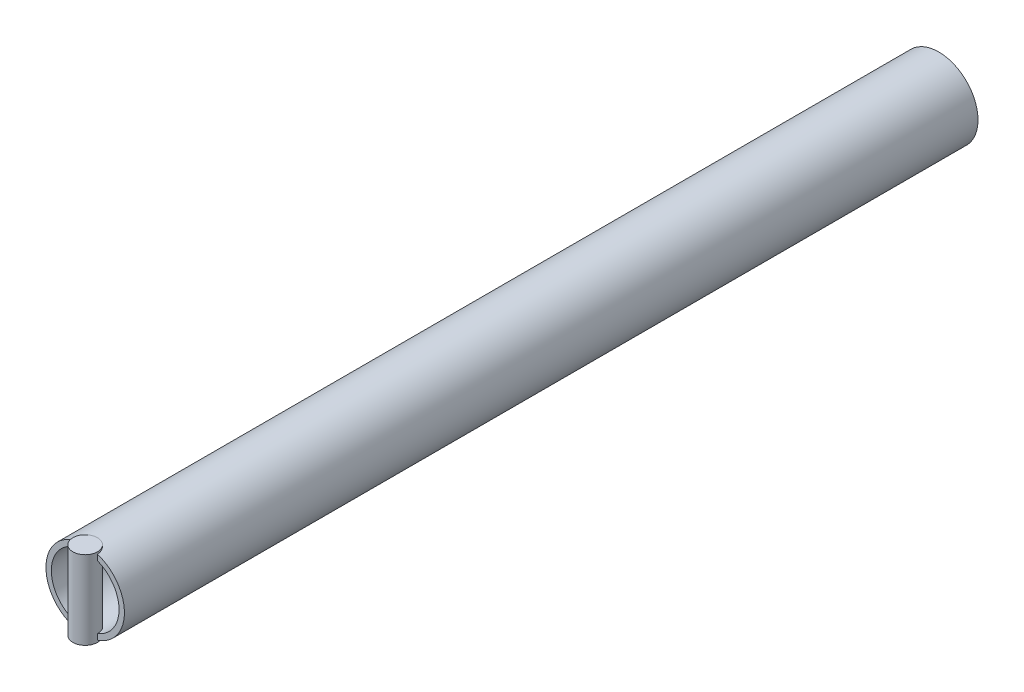
from build123d import *
from build123d.topology import SkipClean

# Parameters (mm, degrees)
SKETCH1_R                = 8
SKETCH1_R_2              = 6.9
BOSS_EXTRUDE1_DEPTH      = 174
BOSS_EXTRUDE2_DEPTH      = 8
BOSS_EXTRUDE2_DEPTH_BACK = 8
SKETCH2_R                = 2.5


with BuildPart() as part:
    # Sketch1 → Boss-Extrude1 (new body)
    with BuildSketch(Plane.XY):
        Circle(SKETCH1_R)
        Circle(SKETCH1_R_2, mode=Mode.SUBTRACT)
    extrude(amount=BOSS_EXTRUDE1_DEPTH)

    # Sketch2 → Boss-Extrude2 (add, two sides: drawn at the far end of the back side and taken through both)
    with SkipClean():  # the faces are left unmerged after this step: merging them gives an invalid solid
        with BuildSketch(Plane(origin=(0, 0, 0), x_dir=(1, 0, 0), z_dir=(0, 1, 0)).offset(-BOSS_EXTRUDE2_DEPTH_BACK)):
            with Locations((0, -174)):
                Circle(SKETCH2_R)
        extrude(amount=BOSS_EXTRUDE2_DEPTH + BOSS_EXTRUDE2_DEPTH_BACK)


solid = part.part
